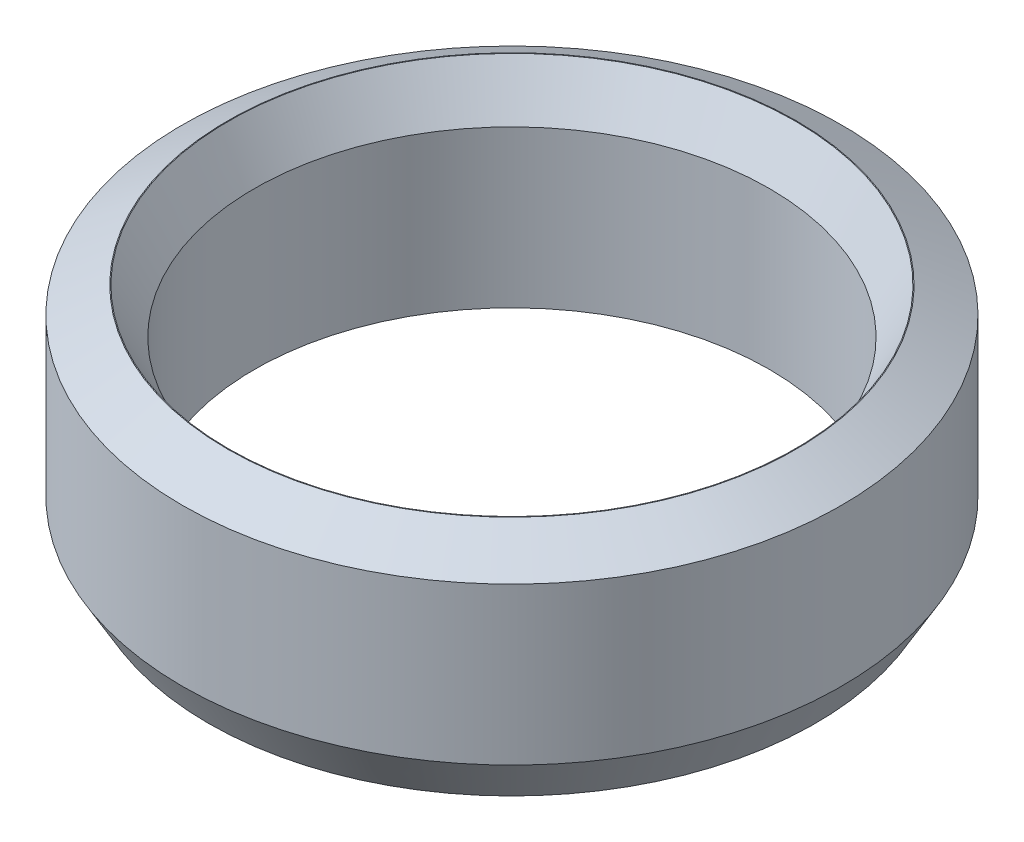
from build123d import *
from OCP.BRepFilletAPI import BRepFilletAPI_MakeChamfer

# Parameters (mm, degrees)
SKETCH1_R           = 32.5
BOSS_EXTRUDE1_DEPTH = 22.482510683
SKETCH2_R           = 25.393927064
CUT_EXTRUDE1_DEPTH  = 52.166036456
CHAMFER1_SIZE       = 2.572712934
CHAMFER1_SIZE2      = 4.456069514


with BuildPart() as part:
    # Sketch1 → Boss-Extrude1 (new body)
    with BuildSketch(Plane(origin=(0, 0, 0), x_dir=(1, 0, 0), z_dir=(0, 1, 0))):
        Circle(SKETCH1_R)
    extrude(amount=BOSS_EXTRUDE1_DEPTH)

    # Sketch2 → Cut-Extrude1 (cut, through all)
    with BuildSketch(Plane(origin=(0, 0, 0), x_dir=(1, 0, 0), z_dir=(0, 1, 0))):
        Circle(SKETCH2_R)
    extrude(amount=CUT_EXTRUDE1_DEPTH, mode=Mode.SUBTRACT)

    # Chamfer1: one chamfer whose edges measure the first distance from different faces: ONE call of the kernel's chamfer builder (chamfer() names one face for all edges)
    chamfer1_edges_1 = [part.edges().sort_by_distance(p)[0] for p in [
        (-25.393927064, 22.482510683, 0),
    ]]
    chamfer1_side_1 = [part.faces().sort_by_distance(p)[0] for p in [
        (-31.580761184, 22.482510683, 0),
    ]]
    chamfer1_edges_2 = [part.edges().sort_by_distance(p)[0] for p in [
        (-25.393927064, 0, 0),
    ]]
    chamfer1_side_2 = [part.faces().sort_by_distance(p)[0] for p in [
        (-25.393927064, 11.241255341, 0),
    ]]
    chamfer1_edges_3 = [part.edges().sort_by_distance(p)[0] for p in [
        (-32.5, 0, 0),
    ]]
    chamfer1_side_3 = [part.faces().sort_by_distance(p)[0] for p in [
        (-31.580761184, 0, 0),
    ]]
    chamfer1_edges_4 = [part.edges().sort_by_distance(p)[0] for p in [
        (-32.5, 22.482510683, 0),
    ]]
    chamfer1_side_4 = [part.faces().sort_by_distance(p)[0] for p in [
        (-32.5, 11.241255341, 0),
    ]]
    chamfer1 = BRepFilletAPI_MakeChamfer(part.part.solid().wrapped)
    for e in chamfer1_edges_1:
        chamfer1.Add(CHAMFER1_SIZE, CHAMFER1_SIZE2, e.wrapped, chamfer1_side_1[0].wrapped)  # the first distance lies on this face
    for e in chamfer1_edges_2:
        chamfer1.Add(CHAMFER1_SIZE, CHAMFER1_SIZE2, e.wrapped, chamfer1_side_2[0].wrapped)  # the first distance lies on this face
    for e in chamfer1_edges_3:
        chamfer1.Add(CHAMFER1_SIZE, CHAMFER1_SIZE2, e.wrapped, chamfer1_side_3[0].wrapped)  # the first distance lies on this face
    for e in chamfer1_edges_4:
        chamfer1.Add(CHAMFER1_SIZE, CHAMFER1_SIZE2, e.wrapped, chamfer1_side_4[0].wrapped)  # the first distance lies on this face
    add(Compound.cast(chamfer1.Shape()), mode=Mode.REPLACE)


solid = part.part
